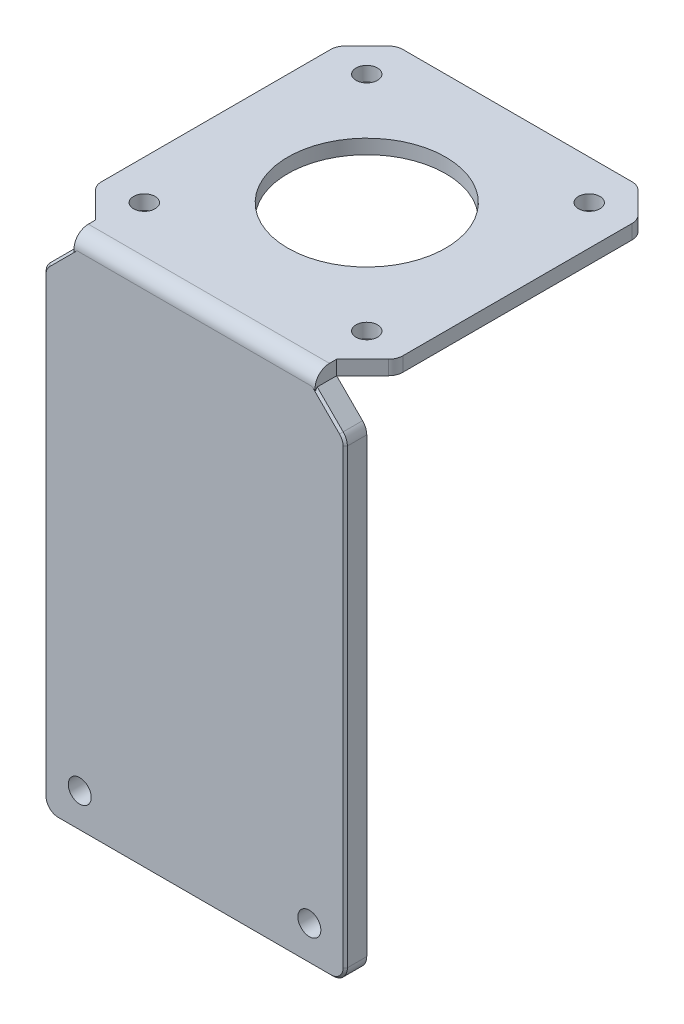
from build123d import *

# Parameters (mm, degrees)
SKETCH_1_R          = 11
SKETCH_1_R_2        = 1.5
EXTRUDE_1_DEPTH     = 2
EXTRUDE_2_DEPTH     = 3
FILLET_1_R          = 2
FILLET_2_R          = 2
FILLET_3_R          = 2
CHAMFER_1_SIZE      = 0.3
SKETCH_3_R          = 1.6
CUT_EXTRUDE_1_DEPTH = 3


with BuildPart() as part:
    # 草图1 → 凸台-拉伸1 (new body)
    with BuildSketch(Plane(origin=(0, 0, 0), x_dir=(1, 0, 0), z_dir=(0, 1, 0))):
        Polygon((16.8, 21), (-16.8, 21), (-21, 16.8), (-21, -16.8), (-16.8, -21), (16.8, -21), (21, -16.8), (21, 16.8), align=None)
        with Locations(Location((0, 0, 0), (0, 0, 270))):
            Circle(SKETCH_1_R, mode=Mode.SUBTRACT)
        with Locations(Location((-15.5, 15.5, 0), (0, 0, 270))):
            Circle(SKETCH_1_R_2, mode=Mode.SUBTRACT)
        with Locations(Location((15.5, 15.5, 0), (0, 0, 90))):
            Circle(SKETCH_1_R_2, mode=Mode.SUBTRACT)
        with Locations(Location((15.5, -15.5, 0), (0, 0, 270))):
            Circle(SKETCH_1_R_2, mode=Mode.SUBTRACT)
        with Locations(Location((-15.5, -15.5, 0), (0, 0, 90))):
            Circle(SKETCH_1_R_2, mode=Mode.SUBTRACT)
    extrude(amount=EXTRUDE_1_DEPTH)

    # 草图2 → 凸台-拉伸2 (add)
    with BuildSketch(Plane.XY.offset(21)):
        Polygon((-21, -70), (21, -70), (21, -4.2), (16.8, 0), (16.8, 2), (-16.8, 2), (-16.8, 0), (-21, -4.2), align=None)
    extrude(amount=EXTRUDE_2_DEPTH)

    # 圆角1
    fillet_1_edges = [part.edges().sort_by_distance(p)[0] for p in [
        (0, 2, 24),
    ]]
    fillet(fillet_1_edges, radius=FILLET_1_R)

    # 圆角2
    fillet_2_edges = [part.edges().sort_by_distance(p)[0] for p in [
        (-21, -70, 22.5),
        (21, -70, 22.5),
    ]]
    fillet(fillet_2_edges, radius=FILLET_2_R)

    # 圆角3
    fillet_3_edges = [part.edges().sort_by_distance(p)[0] for p in [
        (21, 1, -16.8),
        (21, 1, 16.8),
        (-21, 1, 16.8),
        (-21, 1, -16.8),
        (-16.8, 1, -21),
        (16.8, 1, -21),
        (-21, -4.2, 22.5),
        (21, -4.2, 22.5),
    ]]
    fillet(fillet_3_edges, radius=FILLET_3_R)

    # 倒角1
    # the kernel refuses this chamfer: 0.3 mm, written as the material it takes off along each edge
    with BuildSketch(Plane(origin=(20.414213562, -3.614213562, 24), x_dir=(-0.7068394360706586, -0.7068394360706884, 0.027495876610584332), z_dir=(-0.7071067811865624, 0.7071067811865326, 0))) as chamfer_1_piece_1_section:
        Polygon((CHAMFER_1_SIZE * 0.999621916911, -CHAMFER_1_SIZE * 0.0274958766106), (-CHAMFER_1_SIZE * 0.0274958766106, -CHAMFER_1_SIZE * 0.999621916911), (0, 0), align=None)
    chamfer_1_piece_1 = extrude(amount=5.882774734, mode=Mode.PRIVATE)
    chamfer_1_piece_1 = split(chamfer_1_piece_1, bisect_by=Plane(origin=(16.8, -3.46784849, 23.913969067), z_dir=(1, 0, 0)), keep=Keep.TOP, mode=Mode.PRIVATE)
    add(chamfer_1_piece_1, mode=Mode.SUBTRACT)
    with BuildSketch(Plane(origin=(20.414213562, -3.614213562, 24), x_dir=(-0.7068394360706586, -0.7068394360706884, 0.027495876610584332), z_dir=(-0.7071067811865624, 0.7071067811865326, 0))) as chamfer_1_piece_2_section:
        Polygon((CHAMFER_1_SIZE * 0.999621916911, -CHAMFER_1_SIZE * 0.0274958766106), (-CHAMFER_1_SIZE * 0.0274958766106, -CHAMFER_1_SIZE * 0.999621916911), (0, 0), align=None)
    chamfer_1_piece_2 = extrude(amount=5.882774734, mode=Mode.PRIVATE)
    chamfer_1_piece_2 = chamfer_1_piece_2 - Plane(origin=(16.713155259, 0, 22), x_dir=(0, 1, 0), z_dir=(-1, 0, 0)) * Cylinder(2, 13, mode=Mode.PRIVATE)
    add(chamfer_1_piece_2, mode=Mode.SUBTRACT)
    with BuildSketch(Plane(origin=(-21, -5.028427125, 24), x_dir=(0.9996219169112968, 0, 0.027495876610584464), z_dir=(0, -1, 0)), Plane(origin=(21, -68, 24), x_dir=(-0.9996219169112968, 0, 0.027495876610584464), z_dir=(0, 1, 0))) as chamfer_1_piece_3:
        Polygon((CHAMFER_1_SIZE * 0.999621916911, -CHAMFER_1_SIZE * 0.0274958766106), (-CHAMFER_1_SIZE * 0.0274958766106, -CHAMFER_1_SIZE * 0.999621916911), (0, 0), align=None)
    extrude(amount=62.971572875, mode=Mode.SUBTRACT)
    with BuildSketch(Plane(origin=(-19, -5.028427125, 24), x_dir=(-0.7071067811865533, 0.7071067811865418, 0), z_dir=(0.7071067811865418, 0.7071067811865533, 0))) as chamfer_1_piece_4:
        Polygon((2 - CHAMFER_1_SIZE, 0), (2, -CHAMFER_1_SIZE), (2, 0), align=None)
    revolve(axis=Axis((-19, -5.028427125, 24), (0, 0, 1)), revolution_arc=45, mode=Mode.SUBTRACT)
    with BuildSketch(Plane(origin=(19, -5.028427125, 24), x_dir=(1, 0, 0), z_dir=(0, -1, 0))) as chamfer_1_piece_5:
        Polygon((2 - CHAMFER_1_SIZE, 0), (2, -CHAMFER_1_SIZE), (2, 0), align=None)
    revolve(axis=Axis((19, -5.028427125, 24), (0, 0, 1)), revolution_arc=45, mode=Mode.SUBTRACT)
    with BuildSketch(Plane(origin=(-16.254463656, 0.545536344, 24), x_dir=(0.7068394360706796, -0.7068394360706673, 0.027495876610584523), z_dir=(-0.7071067811865415, -0.7071067811865537, 0))) as chamfer_1_piece_6_section:
        Polygon((CHAMFER_1_SIZE * 0.999621916911, -CHAMFER_1_SIZE * 0.0274958766106), (-CHAMFER_1_SIZE * 0.0274958766106, -CHAMFER_1_SIZE * 0.999621916911), (0, 0), align=None)
    chamfer_1_piece_6 = extrude(amount=5.882774734, mode=Mode.PRIVATE)
    chamfer_1_piece_6 = split(chamfer_1_piece_6, bisect_by=Plane(origin=(-16.8, -0.406139504, 23.857619538), z_dir=(-1, 0, 0)), keep=Keep.TOP, mode=Mode.PRIVATE)
    add(chamfer_1_piece_6, mode=Mode.SUBTRACT)
    with BuildSketch(Plane(origin=(-16.254463656, 0.545536344, 24), x_dir=(0.7068394360706796, -0.7068394360706673, 0.027495876610584523), z_dir=(-0.7071067811865415, -0.7071067811865537, 0))) as chamfer_1_piece_7_section:
        Polygon((CHAMFER_1_SIZE * 0.999621916911, -CHAMFER_1_SIZE * 0.0274958766106), (-CHAMFER_1_SIZE * 0.0274958766106, -CHAMFER_1_SIZE * 0.999621916911), (0, 0), align=None)
    chamfer_1_piece_7 = extrude(amount=5.882774734, mode=Mode.PRIVATE)
    chamfer_1_piece_7 = chamfer_1_piece_7 - Plane(origin=(-16.713155259, 0, 22), x_dir=(0, 1, 0), z_dir=(-1, 0, 0)) * Cylinder(2, 13, mode=Mode.PRIVATE)
    add(chamfer_1_piece_7, mode=Mode.SUBTRACT)
    with BuildSketch(Plane(origin=(-19, -70, 24), x_dir=(0, 0.9996219169112968, 0.0274958766105851), z_dir=(1, 0, 0))) as chamfer_1_piece_8:
        Polygon((CHAMFER_1_SIZE * 0.999621916911, -CHAMFER_1_SIZE * 0.0274958766106), (-CHAMFER_1_SIZE * 0.0274958766106, -CHAMFER_1_SIZE * 0.999621916911), (0, 0), align=None)
    extrude(amount=38, mode=Mode.SUBTRACT)
    with BuildSketch(Plane(origin=(19, -68, 24), x_dir=(1, 0, 0), z_dir=(0, 1, 0))) as chamfer_1_piece_9:
        Polygon((2 - CHAMFER_1_SIZE, 0), (2, CHAMFER_1_SIZE), (2, 0), align=None)
    revolve(axis=Axis((19, -68, 24), (0, 0, -1)), revolution_arc=90, mode=Mode.SUBTRACT)
    with BuildSketch(Plane(origin=(-19, -68, 24), x_dir=(-1, 0, 0), z_dir=(0, 1, 0))) as chamfer_1_piece_10:
        Polygon((2 - CHAMFER_1_SIZE, 0), (2, -CHAMFER_1_SIZE), (2, 0), align=None)
    revolve(axis=Axis((-19, -68, 24), (0, 0, 1)), revolution_arc=90, mode=Mode.SUBTRACT)

    # 草图3 → 切除-拉伸1 (cut)
    with BuildSketch(Plane(origin=(0, 0, 21), x_dir=(-1, 0, 0), z_dir=(0, 0, -1))):
        with Locations((-16, -65)):
            Circle(SKETCH_3_R)
        with Locations((16, -65)):
            Circle(SKETCH_3_R)
    extrude(amount=-CUT_EXTRUDE_1_DEPTH, mode=Mode.SUBTRACT)


solid = part.part
